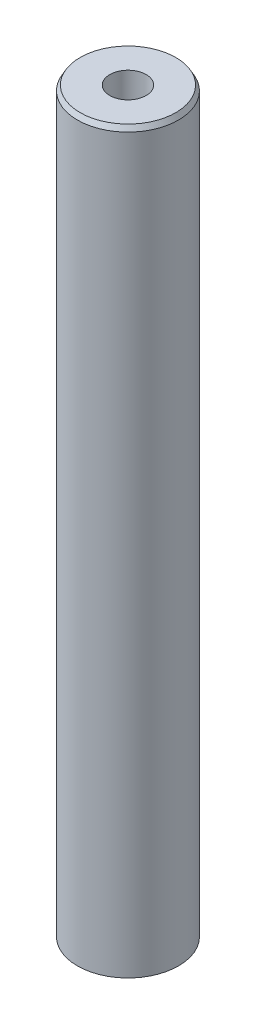
from build123d import *
from OCP.BRepFilletAPI import BRepFilletAPI_MakeChamfer

# Parameters (mm, degrees)
SKETCH1_R           = 15
BOSS_EXTRUDE1_DEPTH = 219.583064211
SKETCH2_R           = 5.396352725
CUT_EXTRUDE1_DEPTH  = 221.605353716
CHAMFER1_SIZE       = 1.489093942
CHAMFER1_SIZE2      = 0.815301303


with BuildPart() as part:
    # Sketch1 → Boss-Extrude1 (new body)
    with BuildSketch(Plane(origin=(0, 0, 0), x_dir=(1, 0, 0), z_dir=(0, 1, 0))):
        Circle(SKETCH1_R)
    extrude(amount=BOSS_EXTRUDE1_DEPTH)

    # Sketch2 → Cut-Extrude1 (cut, through all)
    with BuildSketch(Plane(origin=(0, 0, 0), x_dir=(1, 0, 0), z_dir=(0, 1, 0))):
        Circle(SKETCH2_R)
    extrude(amount=CUT_EXTRUDE1_DEPTH, mode=Mode.SUBTRACT)

    # Chamfer1: one chamfer whose edges measure the first distance from different faces: ONE call of the kernel's chamfer builder (chamfer() names one face for all edges)
    chamfer1_edges_1 = [part.edges().sort_by_distance(p)[0] for p in [
        (-15, 219.583064211, 0),
    ]]
    chamfer1_side_1 = [part.faces().sort_by_distance(p)[0] for p in [
        (-15, 109.791532106, 0),
    ]]
    chamfer1_edges_2 = [part.edges().sort_by_distance(p)[0] for p in [
        (-15, 0, 0),
    ]]
    chamfer1_side_2 = [part.faces().sort_by_distance(p)[0] for p in [
        (-14.575735931, 0, 0),
    ]]
    chamfer1 = BRepFilletAPI_MakeChamfer(part.part.solid().wrapped)
    for e in chamfer1_edges_1:
        chamfer1.Add(CHAMFER1_SIZE, CHAMFER1_SIZE2, e.wrapped, chamfer1_side_1[0].wrapped)  # the first distance lies on this face
    for e in chamfer1_edges_2:
        chamfer1.Add(CHAMFER1_SIZE, CHAMFER1_SIZE2, e.wrapped, chamfer1_side_2[0].wrapped)  # the first distance lies on this face
    add(Compound.cast(chamfer1.Shape()), mode=Mode.REPLACE)


solid = part.part
